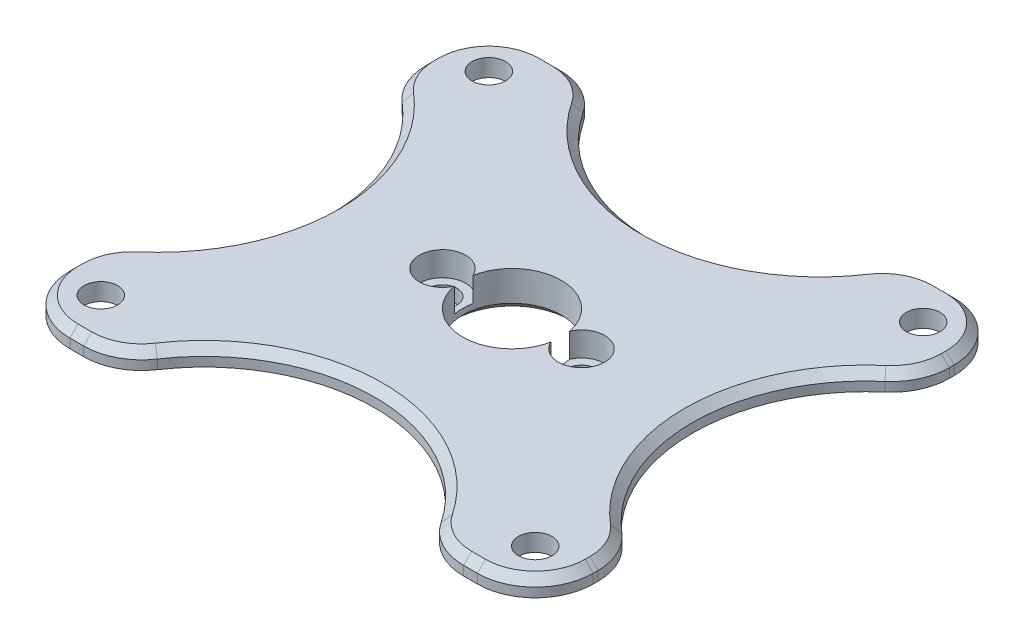
from build123d import *
from build123d.topology import SkipClean

# Parameters (mm, degrees)
SKETCH1_R           = 8.75
SKETCH1_R_2         = 4.25
SKETCH1_R_3         = 1.25
BOSS_EXTRUDE1_DEPTH = 1.8
SKETCH2_R           = 2
CUT_EXTRUDE1_DEPTH  = 0.6
SKETCH3_R           = 1.45
BOSS_EXTRUDE2_DEPTH = 1.5
FILLET1_R           = 5
CHAMFER1_SIZE       = 0.7
CHAMFER2_SIZE       = 0.7


with BuildPart() as part:
    # Sketch1 → Boss-Extrude1 (new body)
    with BuildSketch(Plane(origin=(0, 0, 0), x_dir=(1, 0, 0), z_dir=(0, 1, 0))):
        with Locations(Location((0, 0, 0), (0, 0, 270))):
            Circle(SKETCH1_R)
        with Locations(Location((0, 0, 0), (0, 0, 270))):
            Circle(SKETCH1_R_2, mode=Mode.SUBTRACT)
        with Locations(Location((-6, 0, 0), (0, 0, 270))):
            Circle(SKETCH1_R_3, mode=Mode.SUBTRACT)
        with Locations(Location((6, 0, 0), (0, 0, 270))):
            Circle(SKETCH1_R_3, mode=Mode.SUBTRACT)
    extrude(amount=BOSS_EXTRUDE1_DEPTH)

    # Sketch2 → Cut-Extrude1 (cut)
    with BuildSketch(Plane(origin=(0, 1.8, 0), x_dir=(1, 0, 0), z_dir=(0, 1, 0))):
        with Locations((-6, 0)):
            Circle(SKETCH2_R)
        with Locations((6, 0)):
            Circle(SKETCH2_R)
    extrude(amount=-CUT_EXTRUDE1_DEPTH, mode=Mode.SUBTRACT)

    # Sketch3 → Boss-Extrude2 (add)
    with SkipClean():  # the faces are left unmerged after this step: merging them gives an invalid solid
        with BuildSketch(Plane.XZ.offset(-1.8)):
            with BuildLine():
                Line((-22.592922776, -20.580461491), (-13.466151705, -20.580461491))
                ThreePointArc((-13.466151705, -20.580461491), (0, -11.838443279), (13.466151705, -20.580461491))
                Line((13.466151705, -20.580461491), (22.592922776, -20.580461491))
                Line((22.592922776, -20.580461491), (22.592922776, -12.644988276))
                ThreePointArc((22.592922776, -12.644988276), (15.601572689, 0), (22.592922776, 12.644988276))
                Line((22.592922776, 12.644988276), (22.592922776, 20.580461491))
                Line((22.592922776, 20.580461491), (13.466151705, 20.580461491))
                ThreePointArc((13.466151705, 20.580461491), (0, 11.838443279), (-13.466151705, 20.580461491))
                Line((-13.466151705, 20.580461491), (-22.592922776, 20.580461491))
                Line((-22.592922776, 20.580461491), (-22.592922776, 12.644988276))
                ThreePointArc((-22.592922776, 12.644988276), (-15.601572689, 0), (-22.592922776, -12.644988276))
                Line((-22.592922776, -12.644988276), (-22.592922776, -20.580461491))
            make_face()
            with Locations(Location((18.75, 16.75, 0), (0, 0, 270))):
                Circle(SKETCH3_R, mode=Mode.SUBTRACT)
            with Locations(Location((18.75, -16.75, 0), (0, 0, 270))):
                Circle(SKETCH3_R, mode=Mode.SUBTRACT)
            with Locations(Location((-18.75, -16.75, 0), (0, 0, 270))):
                Circle(SKETCH3_R, mode=Mode.SUBTRACT)
            with Locations(Location((-18.75, 16.75, 0), (0, 0, 270))):
                Circle(SKETCH3_R, mode=Mode.SUBTRACT)
            with BuildLine():
                ThreePointArc((-4.171875, -0.81114671), (0, -4.25), (4.171875, -0.81114671))
                ThreePointArc((4.171875, -0.81114671), (8, 0), (4.171875, 0.81114671))
                ThreePointArc((4.171875, 0.81114671), (0, 4.25), (-4.171875, 0.81114671))
                ThreePointArc((-4.171875, 0.81114671), (-8, 0), (-4.171875, -0.81114671))
            make_face(mode=Mode.SUBTRACT)
        extrude(amount=-BOSS_EXTRUDE2_DEPTH)

    # Fillet1
    fillet1_edges = [part.edges().sort_by_distance(p)[0] for p in [
        (13.466151705, 2.55, 20.580461491),
        (22.592922776, 2.55, 20.580461491),
        (22.592922776, 2.55, 12.644988276),
        (22.592922776, 2.55, -12.644988276),
        (22.592922776, 2.55, -20.580461491),
        (13.466151705, 2.55, -20.580461491),
        (-13.466151705, 2.55, -20.580461491),
        (-22.592922776, 2.55, -20.580461491),
        (-22.592922776, 2.55, -12.644988276),
        (-22.592922776, 2.55, 12.644988276),
        (-22.592922776, 2.55, 20.580461491),
        (-13.466151705, 2.55, 20.580461491),
    ]]
    fillet(fillet1_edges, radius=FILLET1_R)

    # Chamfer1
    # the kernel refuses this chamfer: 0.7 mm, written as the material it takes off along each edge
    with BuildSketch(Plane(origin=(0, 0, 0), x_dir=(0, 0, 1), z_dir=(-1, 0, 0))) as chamfer1_piece_1:
        Polygon((8.75, CHAMFER1_SIZE), (8.75 - CHAMFER1_SIZE, 0), (8.75, 0), align=None)
    revolve(axis=Axis((0, 0, 0), (0, 1, 0)), mode=Mode.SUBTRACT)
    with BuildSketch(Plane(origin=(0, 0, 0), x_dir=(0, 0, 1), z_dir=(-1, 0, 0))) as chamfer1_piece_2:
        Polygon((4.25 + CHAMFER1_SIZE, 0), (4.25, CHAMFER1_SIZE), (4.25, 0), align=None)
    revolve(axis=Axis((0, 0, 0), (0, 1, 0)), mode=Mode.SUBTRACT)

    # Chamfer2
    chamfer2_edges = [part.edges().sort_by_distance(p)[0] for p in [
        (15.601572689, 3.3, 0),
        (16.993372755, 3.3, 20.580461491),
        (22.592922776, 3.3, 15.369960777),
        (16.993372755, 3.3, -20.580461491),
        (0, 3.3, -11.838443279),
        (-16.993372755, 3.3, -20.580461491),
        (-22.592922776, 3.3, -15.369960777),
        (-15.601572689, 3.3, 0),
        (-22.592922776, 3.3, 15.369960777),
        (-16.993372755, 3.3, 20.580461491),
        (0, 3.3, 11.838443279),
        (14.041165239, 3.3, 19.992377481),
        (21.128456682, 3.3, 19.115995397),
        (22.133326206, 3.3, 13.065483774),
        (-21.128456682, 3.3, 19.115995397),
        (-14.041165239, 3.3, 19.992377481),
        (-22.133326206, 3.3, 13.065483774),
        (-22.133326206, 3.3, -13.065483774),
        (14.041165239, 3.3, -19.992377481),
        (-21.128456682, 3.3, -19.115995397),
        (-14.041165239, 3.3, -19.992377481),
        (21.128456682, 3.3, -19.115995397),
        (22.133326206, 3.3, -13.065483774),
        (22.592922776, 3.3, -15.369960777),
    ]]
    chamfer(chamfer2_edges, length=CHAMFER2_SIZE)


solid = part.part
